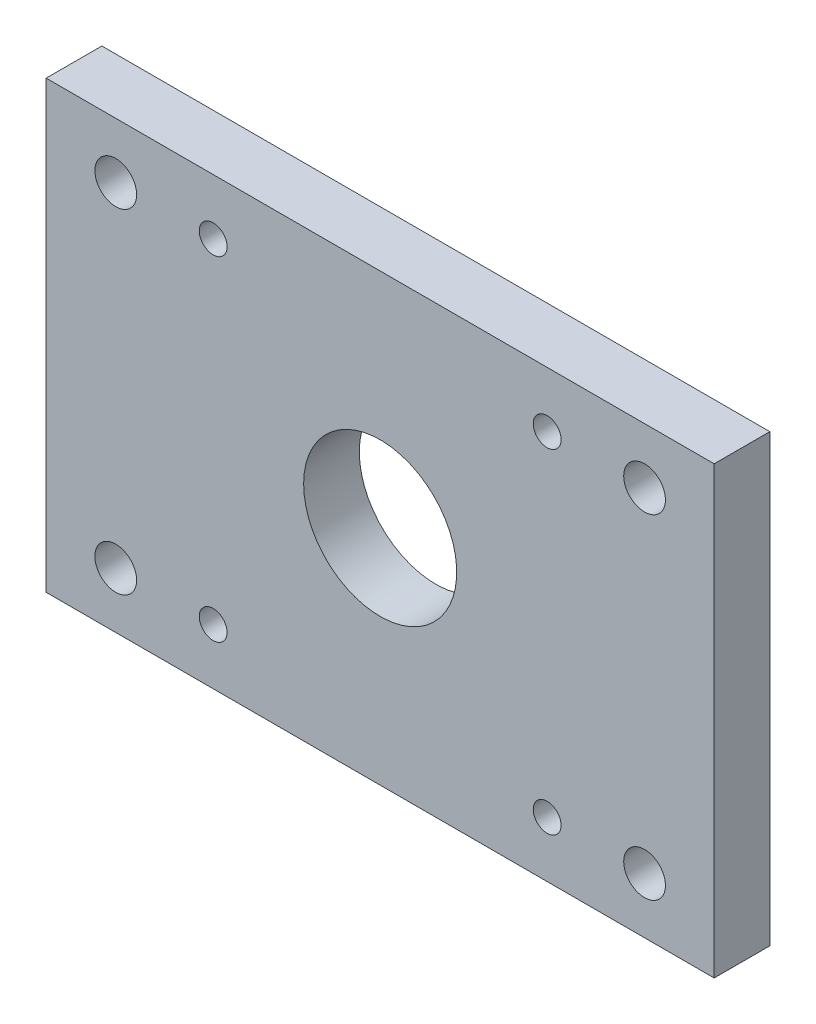
from build123d import *

# Parameters (mm, degrees)
SKETCH1_W               = 76.2
SKETCH1_H               = 50.8
BOSS_EXTRUDE1_DEPTH     = 6.35
SKETCH3_R               = 2.38125
CUT_EXTRUDE6_DEPTH      = 92.800885072
MIRROR2_COPY_1_SKETCH_R = 2.38125
MIRROR2_COPY_1_DEPTH    = 92.800885072
MIRROR2_COPY_2_SKETCH_R = 2.38125
MIRROR2_COPY_2_DEPTH    = 92.800885072
SKETCH2_R               = 8.73125
CUT_EXTRUDE7_DEPTH      = 92.800885072
SKETCH5_R               = 1.5875
CUT_EXTRUDE8_DEPTH      = 92.800885072


with BuildPart() as part:
    # Sketch1 → Boss-Extrude1 (new body)
    with BuildSketch(Plane.XY):
        with Locations((38.1, 25.4)):
            Rectangle(SKETCH1_W, SKETCH1_H)
    extrude(amount=BOSS_EXTRUDE1_DEPTH)

    # Sketch3 → Cut-Extrude6 (cut, through all)
    with BuildSketch(Plane(origin=(0, 0, 0), x_dir=(-1, 0, 0), z_dir=(0, 0, -1))):
        with Locations((-68.2625, 44.45)):
            Circle(SKETCH3_R)
    cut_extrude6 = extrude(amount=-CUT_EXTRUDE6_DEPTH, mode=Mode.SUBTRACT)

    # Mirror1: Cut-Extrude6 across plane
    add(cut_extrude6.mirror(Plane(origin=(38.1, 0, 0), x_dir=(0, 0, 1), z_dir=(1, 0, 0))), mode=Mode.SUBTRACT)

    # Mirror2 copy 1 sketch → Mirror2 copy 1 (cut, through all)
    with BuildSketch(Plane(origin=(76.2, 50.8, 0), x_dir=(1, 0, 0), z_dir=(0, 0, -1))):
        with Locations((-68.2625, 44.45)):
            Circle(MIRROR2_COPY_1_SKETCH_R)
    extrude(amount=-MIRROR2_COPY_1_DEPTH, mode=Mode.SUBTRACT)

    # Mirror2 copy 2 sketch → Mirror2 copy 2 (cut, through all)
    with BuildSketch(Plane(origin=(0, 50.8, 0), x_dir=(-1, 0, 0), z_dir=(0, 0, -1))):
        with Locations((-68.2625, -44.45)):
            Circle(MIRROR2_COPY_2_SKETCH_R)
    extrude(amount=-MIRROR2_COPY_2_DEPTH, mode=Mode.SUBTRACT)

    # Sketch2 → Cut-Extrude7 (cut, through all)
    with BuildSketch(Plane(origin=(0, 0, 0), x_dir=(-1, 0, 0), z_dir=(0, 0, -1))):
        with Locations((-38.1, 25.4)):
            Circle(SKETCH2_R)
    extrude(amount=-CUT_EXTRUDE7_DEPTH, mode=Mode.SUBTRACT)

    # Sketch5 → Cut-Extrude8 (cut, through all)
    with BuildSketch(Plane(origin=(0, 0, 0), x_dir=(-1, 0, 0), z_dir=(0, 0, -1))):
        with Locations((-19.05, 44.45)):
            Circle(SKETCH5_R)
        with Locations((-19.05, 6.35)):
            Circle(SKETCH5_R)
        with Locations((-57.15, 44.45)):
            Circle(SKETCH5_R)
        with Locations((-57.15, 6.35)):
            Circle(SKETCH5_R)
    extrude(amount=-CUT_EXTRUDE8_DEPTH, mode=Mode.SUBTRACT)


solid = part.part
